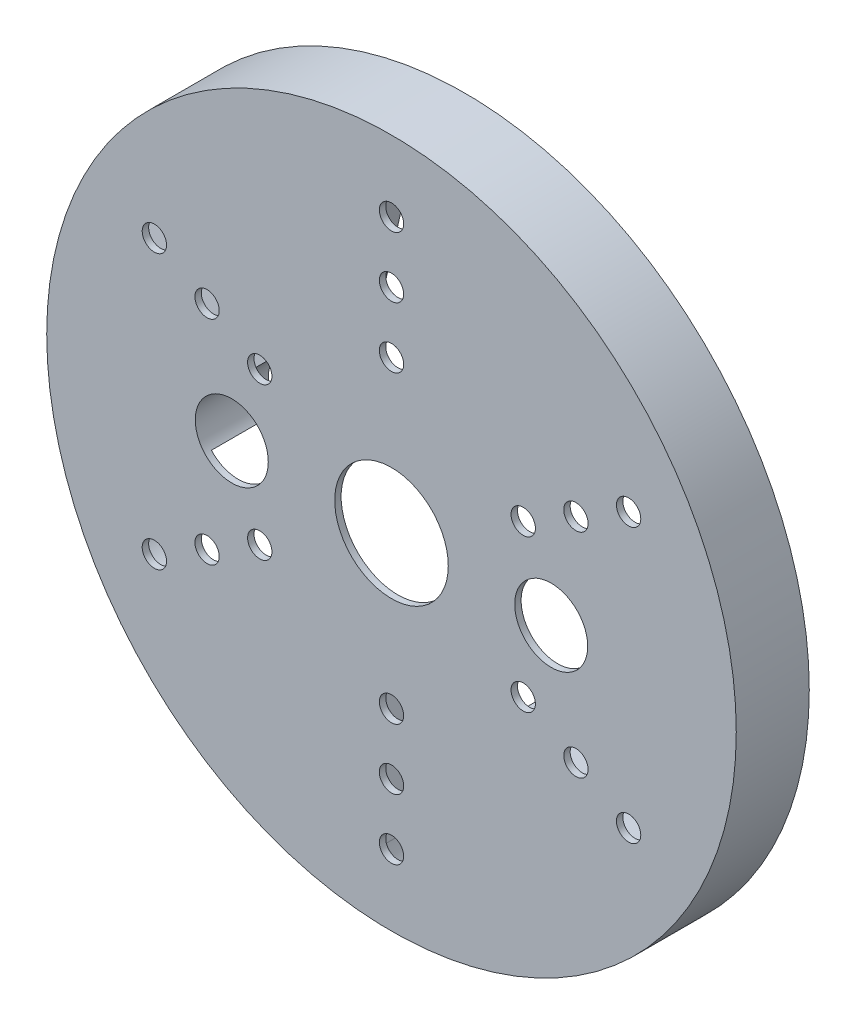
from build123d import *

# Parameters (mm, degrees)
SKETCH1_R               = 17
BOSS_EXTRUDE1_DEPTH     = 3.6
CAVITY1_OUTLINE_R       = 3.15
CAVITY1_DEPTH           = 3.283595969
CAVITY1_START           = 1.183595969
CAVITY1_2_OUTLINE_R     = 3.15
CAVITY1_2_OUTLINE_R_2   = 1.575
CAVITY1_2_DEPTH         = 2.1
SKETCH2_R               = 0.6
CUT_EXTRUDE1_DEPTH      = 10
CIRPATTERN1_COUNT       = 6
SKETCH3_R               = 4.596048158
CUT_EXTRUDE2_DEPTH      = 3.283595969
CUT_EXTRUDE3_DEPTH      = 25.309668858
CUT_EXTRUDE3_DEPTH_BACK = 25.309668858
SKETCH4_R               = 2.8
SKETCH6_R               = 1.8
CUT_EXTRUDE4_DEPTH      = 10


# Read off the part's stored shape, not the designer's step: Cavity1
with BuildPart() as part:
    # Sketch1 → Boss-Extrude1 (new body)
    with BuildSketch(Plane.XY):
        Circle(SKETCH1_R)
    extrude(amount=BOSS_EXTRUDE1_DEPTH)

    # Cavity1 outline → Cavity1 (cut)
    with BuildSketch(Plane.XY):
        with BuildLine():
            Line((3.9375, 6.819950055), (2.048148228, 15.163776711))
            ThreePointArc((2.048148228, 15.163776711), (0, 16.8), (-2.048148228, 15.163776711))
            Line((-2.048148228, 15.163776711), (-3.9375, 6.819950055))
            Line((-3.9375, 6.819950055), (-12.108141735, 9.355636751))
            ThreePointArc((-12.108141735, 9.355636751), (-14.549226784, 8.4), (-14.156289963, 5.80813996))
            Line((-14.156289963, 5.80813996), (-7.875, 0))
            Line((-7.875, 0), (-14.156289963, -5.80813996))
            ThreePointArc((-14.156289963, -5.80813996), (-14.549226784, -8.4), (-12.108141735, -9.355636751))
            Line((-12.108141735, -9.355636751), (-3.9375, -6.819950055))
            Line((-3.9375, -6.819950055), (-2.048148228, -15.163776711))
            ThreePointArc((-2.048148228, -15.163776711), (0, -16.8), (2.048148228, -15.163776711))
            Line((2.048148228, -15.163776711), (3.9375, -6.819950055))
            Line((3.9375, -6.819950055), (12.108141735, -9.355636751))
            ThreePointArc((12.108141735, -9.355636751), (14.549226784, -8.4), (14.156289963, -5.80813996))
            Line((14.156289963, -5.80813996), (7.875, 0))
            Line((7.875, 0), (14.156289963, 5.80813996))
            ThreePointArc((14.156289963, 5.80813996), (14.549226784, 8.4), (12.108141735, 9.355636751))
            Line((12.108141735, 9.355636751), (3.9375, 6.819950055))
        make_face()
        Circle(CAVITY1_OUTLINE_R, mode=Mode.SUBTRACT)
    extrude(amount=CAVITY1_DEPTH, mode=Mode.SUBTRACT)

    # Cavity1 2 outline → Cavity1 2 (cut)
    with BuildSketch(Plane.XY.offset(CAVITY1_START)):
        Circle(CAVITY1_2_OUTLINE_R)
        Circle(CAVITY1_2_OUTLINE_R_2, mode=Mode.SUBTRACT)
    extrude(amount=CAVITY1_2_DEPTH, mode=Mode.SUBTRACT)

    # Sketch2 → Cut-Extrude1 (cut)
    with BuildSketch(Plane(origin=(0, 0, 0), x_dir=(-1, 0, 0), z_dir=(0, 0, -1))):
        with Locations(Location((0, 13.5, 0), (0, 0, 180))):
            Circle(SKETCH2_R)
        with Locations(Location((0, 10.5, 0), (0, 0, 180))):
            Circle(SKETCH2_R)
        with Locations(Location((0, 7.5, 0), (0, 0, 180))):
            Circle(SKETCH2_R)
    cut_extrude1 = extrude(amount=-CUT_EXTRUDE1_DEPTH, mode=Mode.SUBTRACT)

    # CirPattern1: Cut-Extrude1 ×6 about axis
    cirpattern1_axis = Axis((0, 0, 0), (0, 0, 1))
    for i in range(1, CIRPATTERN1_COUNT):
        add(cut_extrude1.rotate(cirpattern1_axis, i * 360 / CIRPATTERN1_COUNT), mode=Mode.SUBTRACT)

    # Sketch3 → Cut-Extrude2 (cut)
    with BuildSketch(Plane(origin=(0, 0, 0), x_dir=(-1, 0, 0), z_dir=(0, 0, -1))):
        Circle(SKETCH3_R)
    extrude(amount=-CUT_EXTRUDE2_DEPTH, mode=Mode.SUBTRACT)

    # Sketch4 → Cut-Extrude3 (cut, two sides: drawn at the far end of the back side and taken through both)
    with BuildSketch(Plane.XY.offset(3.6).offset(-CUT_EXTRUDE3_DEPTH_BACK)):
        Circle(SKETCH4_R)
    extrude(amount=CUT_EXTRUDE3_DEPTH + CUT_EXTRUDE3_DEPTH_BACK, mode=Mode.SUBTRACT)

    # Sketch6 → Cut-Extrude4 (cut)
    with BuildSketch(Plane(origin=(0, 0, 0), x_dir=(-1, 0, 0), z_dir=(0, 0, -1))):
        with Locations(Location((-7.875, 0, 0), (0, 0, 137.241269402))):
            Circle(SKETCH6_R)
        with Locations(Location((7.875, 0, 0), (0, 0, 42.758730598))):
            Circle(SKETCH6_R)
    extrude(amount=-CUT_EXTRUDE4_DEPTH, mode=Mode.SUBTRACT)


solid = part.part
